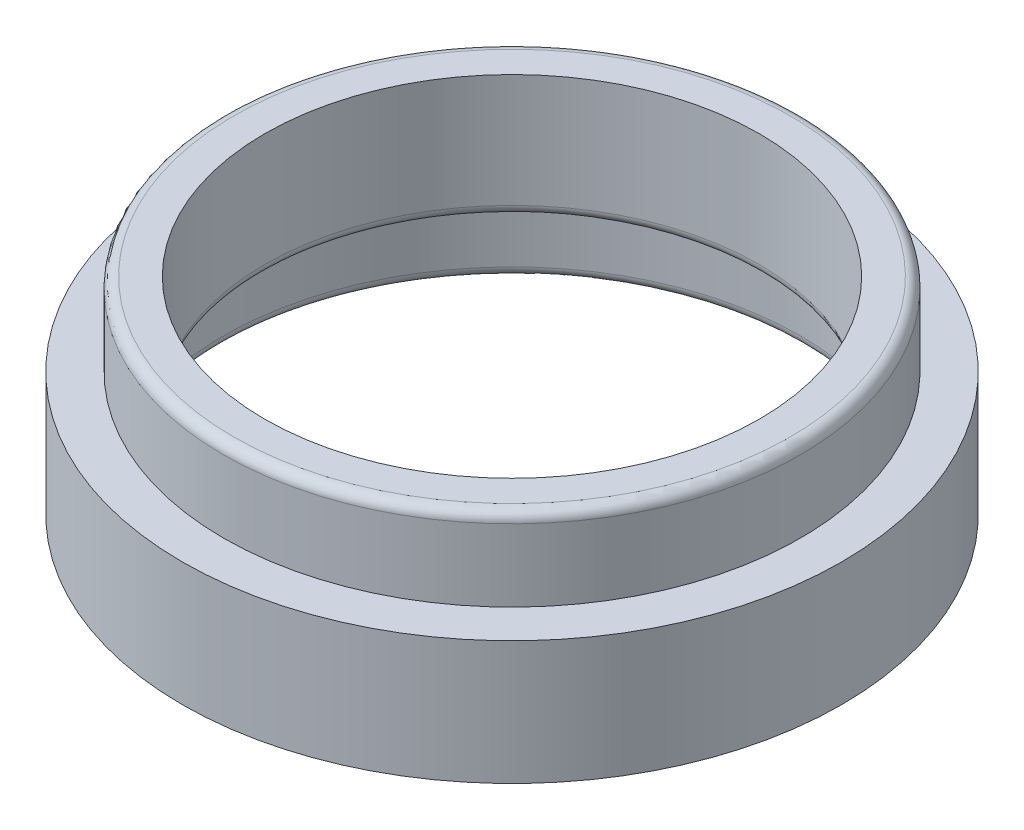
from build123d import *

# Parameters (mm, degrees)
FILLET1_R = 0.79375


with BuildPart() as part:
    # Sketch1 → Revolve1 (revolve)
    with BuildSketch(Plane(origin=(0, 0, 0), x_dir=(0, 0, -1), z_dir=(1, 0, 0))):
        Polygon((22.225, 11.1125), (22.225, 4.7625), (25.4, 4.7625), (25.4, -4.7625), (22.225, -4.7625), (22.225, 1.5875), (19.05, 1.5875), (19.05, 11.1125), align=None)
    revolve(axis=Axis((0, -32.325211936, 0), (0, 1, 0)))

    # Fillet1
    fillet1_edges = [part.edges().sort_by_distance(p)[0] for p in [
        (0, 1.5875, 22.225),
        (0, -4.7625, 22.225),
        (0, 11.1125, 22.225),
        (0, 1.5875, 19.05),
    ]]
    fillet(fillet1_edges, radius=FILLET1_R)


solid = part.part
